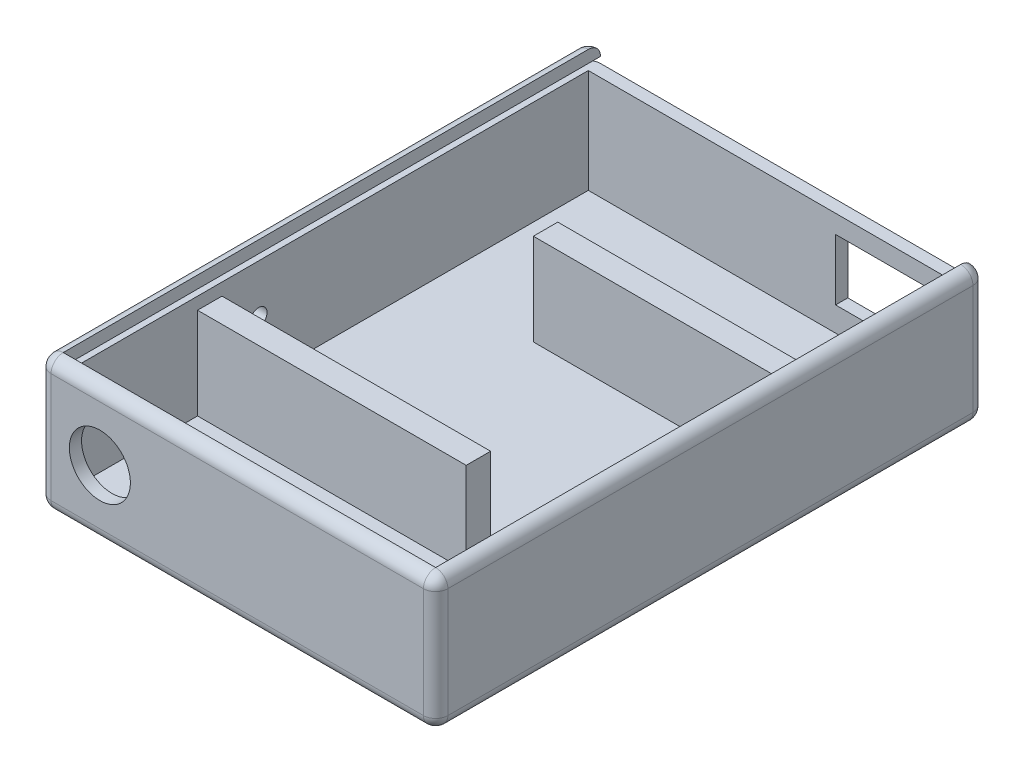
from build123d import *

# Parameters (mm, degrees)
SKETCH1_W           = 82.55
SKETCH1_H           = 114.3
BOSS_EXTRUDE1_DEPTH = 27.94
FILLET1_R           = 2.54
SHELL2_START        = -38.735
SHELL2_OUTLINE_W    = 25.4
SHELL2_OUTLINE_H    = 109.22
SHELL2_DEPTH        = 77.47
SKETCH2_W           = 55.88
SKETCH2_H           = 5.08
BOSS_EXTRUDE2_DEPTH = 19.05
CUT_EXTRUDE1_REACH  = 106.217
SKETCH3_R           = 1.75
CUT_EXTRUDE2_REACH  = 126.695
SKETCH4_R           = 6.35
CUT_EXTRUDE3_REACH  = 126.695
SKETCH5_W           = 19.05
SKETCH5_H           = 12.7
SKETCH6_W           = 38.735
SKETCH6_H           = 2.54
SKETCH6_H_2         = 1.27
SKETCH6_W_2         = 1.27
CUT_EXTRUDE4_DEPTH  = 111.76


# Read off the part's stored shape, not the designer's step: Shell2
with BuildPart() as part:
    # Sketch1 → Boss-Extrude1 (new body)
    with BuildSketch(Plane(origin=(0, 0, 0), x_dir=(1, 0, 0), z_dir=(0, 1, 0))):
        Rectangle(SKETCH1_W, SKETCH1_H)
    extrude(amount=BOSS_EXTRUDE1_DEPTH)

    # Fillet1
    fillet1_edges = [part.edges().sort_by_distance(p)[0] for p in [
        (-41.275, 27.94, 0),
        (0, 27.94, 57.15),
        (41.275, 27.94, 0),
        (0, 0, 57.15),
        (-41.275, 0, 0),
        (0, 0, -57.15),
        (41.275, 0, 0),
        (41.275, 13.97, 57.15),
        (-41.275, 13.97, 57.15),
        (-41.275, 13.97, -57.15),
        (41.275, 13.97, -57.15),
        (0, 27.94, -57.15),
    ]]
    fillet(fillet1_edges, radius=FILLET1_R)

    # Shell2 outline → Shell2 (cut)
    with BuildSketch(Plane.YZ.offset(SHELL2_START)):
        with Locations((15.24, 0)):
            Rectangle(SHELL2_OUTLINE_W, SHELL2_OUTLINE_H)
    extrude(amount=SHELL2_DEPTH, mode=Mode.SUBTRACT)

    # Sketch2 → Boss-Extrude2 (add)
    with BuildSketch(Plane(origin=(0, 2.54, 0), x_dir=(1, 0, 0), z_dir=(0, 1, 0))):
        with Locations((-10.795, -24.13)):
            Rectangle(SKETCH2_W, SKETCH2_H)
        with Locations((10.795, 24.13)):
            Rectangle(SKETCH2_W, SKETCH2_H)
    extrude(amount=BOSS_EXTRUDE2_DEPTH)

    # Sketch3 → Cut-Extrude1 (cut, up to next)
    with BuildSketch(Plane.ZY.offset(41.275), mode=Mode.PRIVATE) as cut_extrude1_sk1:
        with Locations((13.97, 13.97)):
            Circle(SKETCH3_R)
    cut_extrude1_tool1 = extrude(cut_extrude1_sk1.sketch, amount=-CUT_EXTRUDE1_REACH, mode=Mode.PRIVATE) & part.part
    add(cut_extrude1_tool1.solids().sort_by_distance((-41.275, 13.97, 13.97))[0], mode=Mode.SUBTRACT)

    # Sketch4 → Cut-Extrude2 (cut, up to next)
    with BuildSketch(Plane.XY.offset(57.15), mode=Mode.PRIVATE) as cut_extrude2_sk1:
        with Locations((-28.575, 13.97)):
            Circle(SKETCH4_R)
    cut_extrude2_tool1 = extrude(cut_extrude2_sk1.sketch, amount=-CUT_EXTRUDE2_REACH, mode=Mode.PRIVATE) & part.part
    add(cut_extrude2_tool1.solids().sort_by_distance((-28.575, 13.97, 57.15))[0], mode=Mode.SUBTRACT)

    # Sketch5 → Cut-Extrude3 (cut, up to next)
    with BuildSketch(Plane(origin=(0, 0, -57.15), x_dir=(-1, 0, 0), z_dir=(0, 0, -1)), mode=Mode.PRIVATE) as cut_extrude3_sk1:
        with Locations((-22.225, 13.97)):
            Rectangle(SKETCH5_W, SKETCH5_H)
    cut_extrude3_tool1 = extrude(cut_extrude3_sk1.sketch, amount=-CUT_EXTRUDE3_REACH, mode=Mode.PRIVATE) & part.part
    add(cut_extrude3_tool1.solids().sort_by_distance((22.225, 13.97, -57.15))[0], mode=Mode.SUBTRACT)

    # Sketch6 → Cut-Extrude4 (cut)
    with BuildSketch(Plane(origin=(0, 0, -57.15), x_dir=(-1, 0, 0), z_dir=(0, 0, -1))):
        with Locations((-19.3675, 26.67)):
            Rectangle(SKETCH6_W, SKETCH6_H)
        with Locations((-19.3675, 24.765)):
            Rectangle(SKETCH6_W, SKETCH6_H_2)
        with Locations((-39.37, 24.765)):
            Rectangle(SKETCH6_W_2, SKETCH6_H_2)
        with Locations((39.37, 24.765)):
            Rectangle(SKETCH6_W_2, SKETCH6_H_2)
        with Locations((19.3675, 26.67)):
            Rectangle(SKETCH6_W, SKETCH6_H)
        with Locations((19.3675, 24.765)):
            Rectangle(SKETCH6_W, SKETCH6_H_2)
    extrude(amount=-CUT_EXTRUDE4_DEPTH, mode=Mode.SUBTRACT)


solid = part.part
